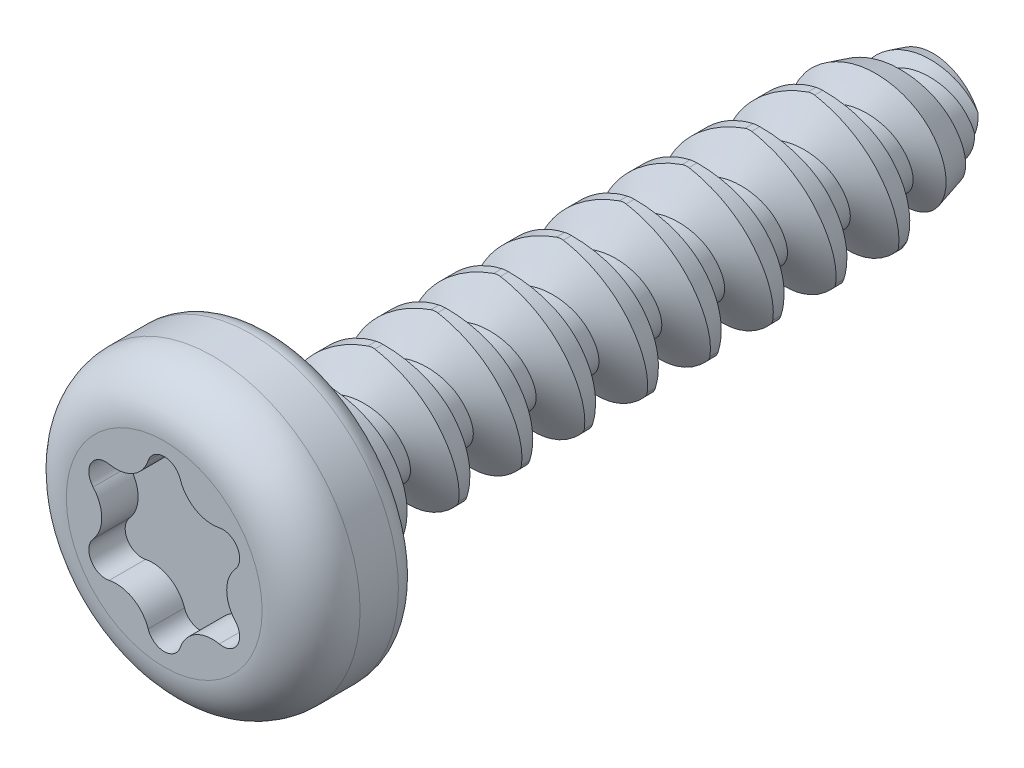
from build123d import *

# Parameters (mm, degrees)
SKETCH1_R           = 2.1209
EXTRUDE3_DEPTH      = 1.5748
SKETCH17_W          = 9.525
SKETCH17_H          = 0.601194526
SWEEP1_PITCH        = 0.907142857
LPATTERN3_COUNT     = 10
LPATTERN3_PITCH     = 0.907142857
LPATTERN3_COL_COUNT = 2
LPATTERN3_COL_PITCH = 0.907142857
CUT_EXTRUDE1_DEPTH  = 0.524933333
CIRPATTERN1_COUNT   = 6
SKETCH18_OUTSIDE_W  = 8.766
SKETCH18_OUTSIDE_H  = 8.766
CUT_EXTRUDE3_DEPTH  = 9.525


with BuildPart() as part:
    # Sketch1 → Extrude3 (new body)
    with BuildSketch(Plane.XY):
        Circle(SKETCH1_R)
    extrude(amount=EXTRUDE3_DEPTH)

    # Sketch11 → Cut-Revolve3 (revolve, cut)
    with BuildSketch(Plane(origin=(0, 0, 0), x_dir=(0, 0, -1), z_dir=(1, 0, 0)), mode=Mode.PRIVATE) as cut_revolve3_sk:
        with BuildLine():
            Line((-0.867833333, 2.1209), (-0.31496, 2.1209))
            ThreePointArc((-0.31496, 2.1209), (-0.092249648, 2.028650352), (0, 1.80594))
            Line((0, 1.80594), (0.254, 1.80594))
            Line((0.254, 1.80594), (0.254, 2.3749))
            Line((0.254, 2.3749), (-1.8288, 2.3749))
            Line((-1.8288, 2.3749), (-1.8288, 1.413933333))
            Line((-1.8288, 1.413933333), (-1.5748, 1.413933333))
            ThreePointArc((-1.5748, 1.413933333), (-1.367734257, 1.913834257), (-0.867833333, 2.1209))
        make_face()
    revolve(cut_revolve3_sk.sketch.rotate(Axis((0, 0, 0), (0, 0, 1)), 90), axis=Axis((0, 0, 0), (0, 0, 1)), mode=Mode.SUBTRACT)

    # Sketch12 → Cut-Extrude1 (cut)
    with BuildSketch(Plane.XY.offset(1.5748)):
        with BuildLine():
            Line((-0.451124677, 0.781370861), (0, 0))
            Line((0, 0), (0.451124677, 0.781370861))
            ThreePointArc((0.451124677, 0.781370861), (0.316474681, 0.89618022), (0.231654892, 1.051478043))
            ThreePointArc((0.231654892, 1.051478043), (0, 1.2192), (-0.231654892, 1.051478043))
            ThreePointArc((-0.231654892, 1.051478043), (-0.316474681, 0.89618022), (-0.451124677, 0.781370861))
        make_face()
    cut_extrude1 = extrude(amount=-CUT_EXTRUDE1_DEPTH, mode=Mode.SUBTRACT)

    # CirPattern1: Cut-Extrude1 ×6 about axis
    cirpattern1_axis = Axis((0, 0, 0), (0, 0, 1))
    for i in range(1, CIRPATTERN1_COUNT):
        add(cut_extrude1.rotate(cirpattern1_axis, i * 360 / CIRPATTERN1_COUNT), mode=Mode.SUBTRACT)


with BuildPart() as body_2:
    # Sketch17 → Revolve1 (revolve)
    with BuildSketch(Plane(origin=(0, 0, 0), x_dir=(0, 0, -1), z_dir=(1, 0, 0)), mode=Mode.PRIVATE) as revolve1_sk:
        with Locations((4.7625, 0.300597263)):
            Rectangle(SKETCH17_W, SKETCH17_H)
    revolve(revolve1_sk.sketch.rotate(Axis((0, 0, 0), (0, 0, 1)), 90), axis=Axis((0, 0, 0), (0, 0, 1)))

    # Sweep1: the profile of Sketch14 profile screwed along a right-hand helix of 1.5 turns, 6 arcs to a turn; built about Z, then put on its axis
    sweep1_z = Axis((0, 0, 0), (0, 0, 1))
    sweep1_corners = [(1.0922, 0, -0.056696429), (1.0922, 0, 0.056696429), (0.600894526, 0, 0.340351777), (0.600894526, 0, -0.340351777)]
    with BuildLine(mode=Mode.PRIVATE) as sweep1_profile:
        Line(sweep1_corners[0], sweep1_corners[1])
        Line(sweep1_corners[1], sweep1_corners[2])
        Line(sweep1_corners[2], sweep1_corners[3])
        Line(sweep1_corners[3], sweep1_corners[0])
    sweep1_cap = Face(sweep1_profile.wire())
    sweep1_turn_angles = [0, 30, 60, 90, 120, 150, 180, 210, 240, 270, 300, 330, 360]
    sweep1_turn_weights = [1, 0.8660254037844387, 1, 0.8660254037844387, 1, 0.8660254037844387, 1, 0.8660254037844387, 1, 0.8660254037844387, 1, 0.8660254037844387, 1]
    sweep1_turn_rails = [Edge.make_bspline([Vector(p[0], p[1], 0).rotate(sweep1_z, sweep1_turn_angles[k]) / sweep1_turn_weights[k] + Vector(0, 0, p[2] + SWEEP1_PITCH * sweep1_turn_angles[k] / 360) for k in range(13)], [0, 0, 0, 1, 1, 2, 2, 3, 3, 4, 4, 5, 5, 6, 6, 6], 2, sweep1_turn_weights) for p in sweep1_corners]
    sweep1_turn_sides = [Face.make_surface_from_curves(sweep1_turn_rails[p[0]], sweep1_turn_rails[p[1]]) for p in [(0, 1), (1, 2), (2, 3), (3, 0)]]
    sweep1_last_angles = [360, 390, 420, 450, 480, 510, 540]
    sweep1_last_weights = [1, 0.8660254037844387, 1, 0.8660254037844387, 1, 0.8660254037844342, 1]
    sweep1_last_rails = [Edge.make_bspline([Vector(p[0], p[1], 0).rotate(sweep1_z, sweep1_last_angles[k]) / sweep1_last_weights[k] + Vector(0, 0, p[2] + SWEEP1_PITCH * sweep1_last_angles[k] / 360) for k in range(7)], [0, 0, 0, 1, 1, 2, 2, 3, 3, 3], 2, sweep1_last_weights) for p in sweep1_corners]
    sweep1_last_sides = [Face.make_surface_from_curves(sweep1_last_rails[p[0]], sweep1_last_rails[p[1]]) for p in [(0, 1), (1, 2), (2, 3), (3, 0)]]
    sweep1 = Plane(origin=(0, 0, -0.566964286), x_dir=(0, 1, 0), z_dir=(0, 0, -1)) * Solid(Shell([*sweep1_turn_sides, *sweep1_last_sides, sweep1_cap, sweep1_cap.rotate(sweep1_z, 540).moved(Location((0, 0, SWEEP1_PITCH * 540 / 360)))]))
    add(sweep1)

    # LPattern3: Sweep1 ×10
    with Locations(*[(0, 0, -i * LPATTERN3_PITCH) for i in range(1, LPATTERN3_COUNT)]):
        add(sweep1)

    # LPattern3 col: Sweep1 ×2
    with Locations(*[(0, 0, i * LPATTERN3_COL_PITCH) for i in range(1, LPATTERN3_COL_COUNT)]):
        add(sweep1)

    # Sketch13 → Cut-Revolve4 (revolve, cut)
    with BuildSketch(Plane(origin=(0, 0, 0), x_dir=(0, 0, -1), z_dir=(1, 0, 0)), mode=Mode.PRIVATE) as cut_revolve4_sk:
        Polygon((9.525, 0.7112), (8.1407, 1.0922), (9.525, 1.0922), (12.065, 1.0922), (12.065, 0), (9.525, 0), align=None)
    revolve(cut_revolve4_sk.sketch.rotate(Axis((0, 0, 0), (0, 0, -1)), 270), axis=Axis((0, 0, 0), (0, 0, -1)), mode=Mode.SUBTRACT)

    # Sketch18 outside → Cut-Extrude3 (cut)
    with BuildSketch(Plane(origin=(0, 0, -9.525), x_dir=(-1, 0, 0), z_dir=(0, 0, -1))):
        Rectangle(SKETCH18_OUTSIDE_W, SKETCH18_OUTSIDE_H)
        with BuildLine():
            ThreePointArc((-0.04353726, 1.08781733), (0, 1.0922), (0.04353726, 1.08781733))
            ThreePointArc((0.04353726, 1.08781733), (0.862747235, 0.498107348), (0.963846073, -0.506204292))
            ThreePointArc((0.963846073, -0.506204292), (0.945872946, -0.5461), (0.920308812, -0.581613039))
            ThreePointArc((0.920308812, -0.581613039), (0, -0.996214697), (-0.920308812, -0.581613039))
            ThreePointArc((-0.920308812, -0.581613039), (-0.945872946, -0.5461), (-0.963846073, -0.506204292))
            ThreePointArc((-0.963846073, -0.506204292), (-0.862747235, 0.498107348), (-0.04353726, 1.08781733))
        make_face(mode=Mode.SUBTRACT)
    extrude(amount=-CUT_EXTRUDE3_DEPTH, mode=Mode.SUBTRACT)


solid = Compound([part.part, body_2.part])
